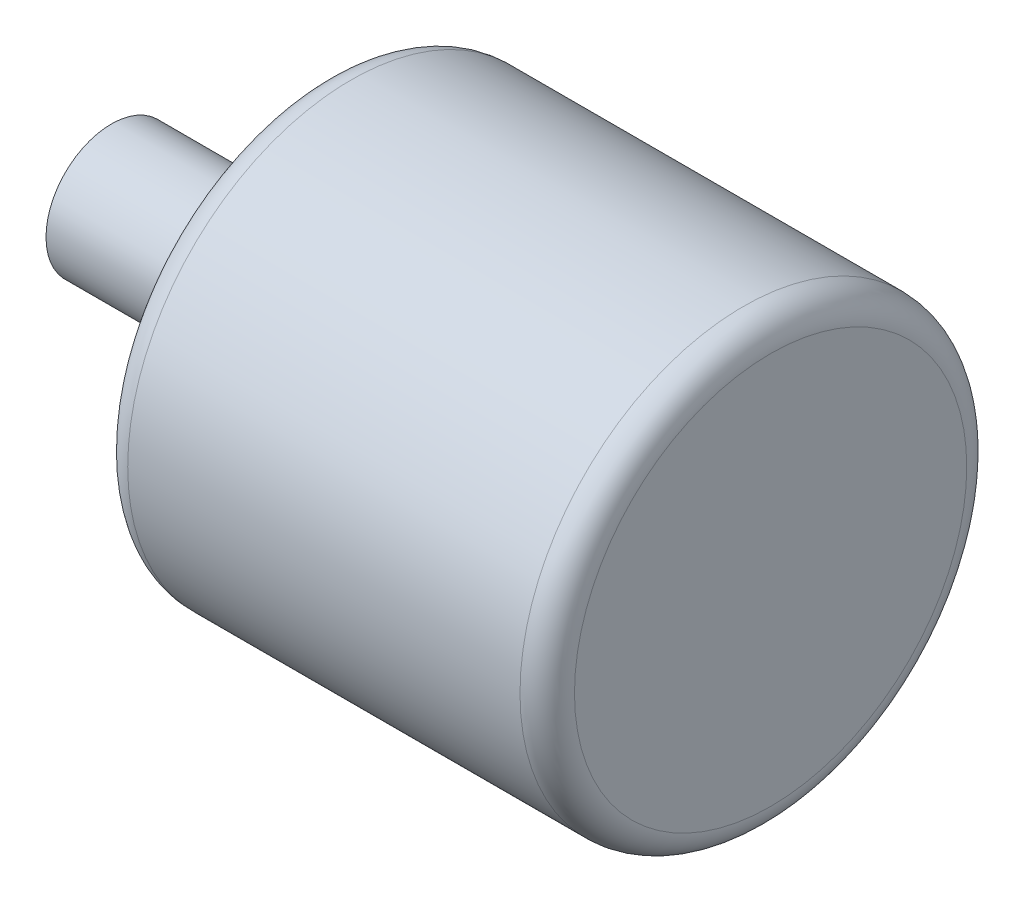
from build123d import *

# Parameters (mm, degrees)
FILLET4_R = 45
FILLET5_R = 25


# Read off the part's stored shape, not the designer's step: Shell3
with BuildPart() as part:
    # Sketch1 → Revolve2 (revolve)
    with BuildSketch(Plane(origin=(0, 0, 0), x_dir=(1, 0, 0), z_dir=(0, 1, 0)), mode=Mode.PRIVATE) as revolve2_sk:
        Polygon((195, 60), (0, 60), (0, 0), (605, 0), (605, 205), (195, 205), align=None)
    revolve(revolve2_sk.sketch.rotate(Axis((-1000, 0, 0), (1, 0, 0)), 180), axis=Axis((-1000, 0, 0), (1, 0, 0)))

    # Fillet4
    fillet4_edges = [part.edges().sort_by_distance(p)[0] for p in [
        (195, 0, -60),
    ]]
    fillet(fillet4_edges, radius=FILLET4_R)

    # Fillet5
    fillet5_edges = [part.edges().sort_by_distance(p)[0] for p in [
        (195, 0, -205),
        (605, 0, -205),
    ]]
    fillet(fillet5_edges, radius=FILLET5_R)

    # Shell3 outline → Shell3 (revolve, cut)
    with BuildSketch(Plane.YX):
        with BuildLine():
            Line((0, 595), (0, 0))
            Line((0, 0), (55, 0))
            Line((55, 0), (55, 150))
            ThreePointArc((55, 150), (69.644660941, 185.355339059), (105, 200))
            Line((105, 200), (180, 200))
            ThreePointArc((180, 200), (194.142135624, 205.857864376), (200, 220))
            Line((200, 220), (200, 580))
            ThreePointArc((200, 580), (198.228756555, 588.228756555), (193.228756555, 595))
            Line((193.228756555, 595), (0, 595))
        make_face()
    revolve(axis=Axis((0, 0, 0), (1, 0, 0)), mode=Mode.SUBTRACT)


solid = part.part
